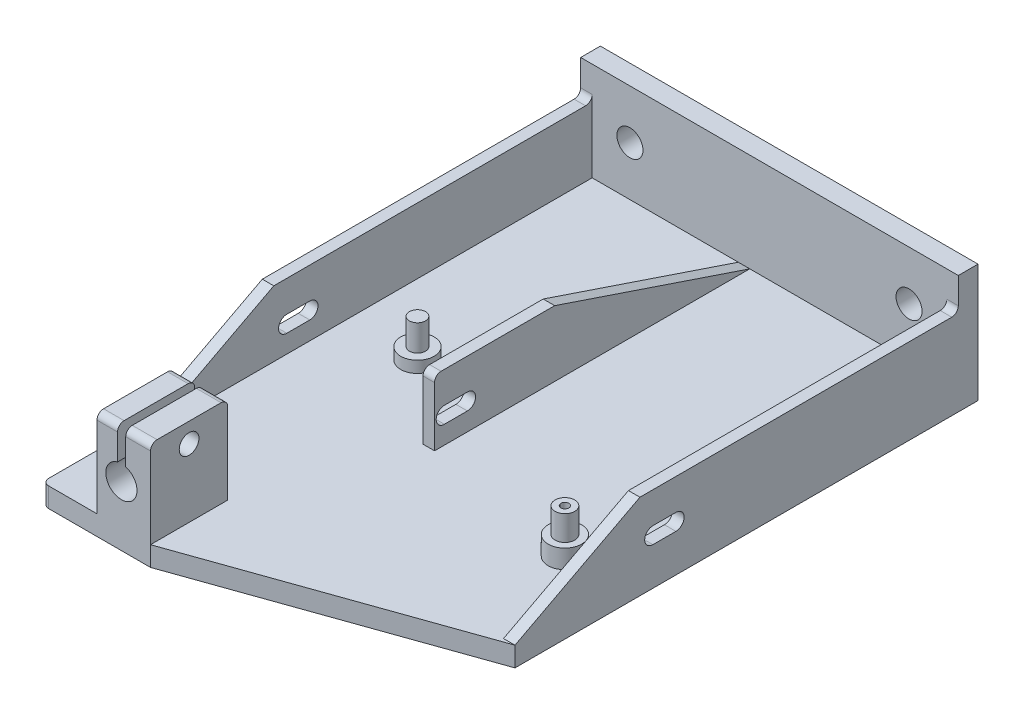
from build123d import *

# Parameters (mm, degrees)
SKETCH1_W                               = 115
SKETCH1_H                               = 170
BACK_WALL_EXTRUDE_DEPTH                 = 6
SKETCH2_W                               = 115
SKETCH2_H                               = 6
BOTTOM_PLATE_EXTRUDE_DEPTH              = 30
SKETCH3_W                               = 3.5
SKETCH3_H                               = 135
SKETCH3_H_2                             = 96
SIDE_WALLS_EXTRUDE_DEPTH                = 20
SKETCH4_W                               = 16.3
SKETCH4_H                               = 23.5
DIAL_INDIACTOR_HOLDER_EXTRUDE_DEPTH     = 26.7
DIAL_INDICATOR_HOLE_CUT_DEPTH           = 26.7
SKETCH6_R                               = 3
DIAL_INDICATOR_TIGHTENER_HOLE_CUT_DEPTH = 26.7
SKETCH7_R                               = 5.1
ARM_BASE_EXTRUDE_DEPTH                  = 5.7
SKETCH8_R                               = 3
ARM_AXLE_EXTRUDE_DEPTH                  = 7.6
SKETCH9_R                               = 5.1
GUIDE_WHEEL_BASE_EXTRUDE_DEPTH          = 3.5
SKETCH10_R                              = 2.45
GUIDE_WHEEL_AXLE_EXTRUDE_DEPTH          = 8
FILAMENT_START                          = 71.967294703
FILAMENT_SLOT_CUT_OUTLINE_W             = 100
FILAMENT_SLOT_CUT_OUTLINE_H             = 6
FILAMENT_SLOT_CUT_DEPTH                 = 27.34055864
FILAMENT_START_2                        = -115
FILAMENT_SLOT_CUT_2_DEPTH               = 116
SKETCH13_R                              = 3.96875
MOUNTING_HOLES_CUT_DEPTH                = 8
FILLET1_R                               = 2
CUT_EXTRUDE9_DEPTH                      = 8
SKETCH15_R                              = 1.225
SCREW_HOLE_CUT_DEPTH                    = 105.420974904
CUT_EXTRUDE11_DEPTH                     = 148.465250144


with BuildPart() as part:
    # Sketch1 → Back Wall Extrude (new body)
    with BuildSketch(Plane(origin=(0, 0, 0), x_dir=(1, 0, 0), z_dir=(0, 1, 0))):
        Rectangle(SKETCH1_W, SKETCH1_H)
    extrude(amount=BACK_WALL_EXTRUDE_DEPTH)

    # Sketch2 → Bottom Plate Extrude (add)
    with BuildSketch(Plane(origin=(0, 6, 0), x_dir=(1, 0, 0), z_dir=(0, 1, 0))):
        with Locations((0, 82)):
            Rectangle(SKETCH2_W, SKETCH2_H)
    extrude(amount=BOTTOM_PLATE_EXTRUDE_DEPTH)

    # Sketch3 → Side Walls Extrude (add)
    with BuildSketch(Plane(origin=(0, 6, 0), x_dir=(1, 0, 0), z_dir=(0, 1, 0))):
        with Locations((-55.75, 11.5)):
            Rectangle(SKETCH3_W, SKETCH3_H)
        with Locations((55.75, 11.5)):
            Rectangle(SKETCH3_W, SKETCH3_H)
        with Locations((-7.75, 31)):
            Rectangle(SKETCH3_W, SKETCH3_H_2)
    extrude(amount=SIDE_WALLS_EXTRUDE_DEPTH)

    # Sketch4 → Dial Indiactor Holder Extrude (add)
    with BuildSketch(Plane(origin=(0, 6, 0), x_dir=(1, 0, 0), z_dir=(0, 1, 0))):
        with Locations((-32.65, -73.25)):
            Rectangle(SKETCH4_W, SKETCH4_H)
    extrude(amount=DIAL_INDIACTOR_HOLDER_EXTRUDE_DEPTH)

    # Sketch5 → Dial Indicator Hole Cut (cut)
    with BuildSketch(Plane.XY.offset(85)):
        with BuildLine():
            Line((-34.538403692, 32.7), (-32.038403692, 32.7))
            Line((-32.038403692, 32.7), (-32.038403692, 22.762553146))
            ThreePointArc((-32.038403692, 22.762553146), (-33.433435972, 13.450573614), (-34.538403692, 22.801409096))
            Line((-34.538403692, 22.801409096), (-34.538403692, 32.7))
        make_face()
    extrude(amount=-DIAL_INDICATOR_HOLE_CUT_DEPTH, mode=Mode.SUBTRACT)

    # Sketch6 → Dial Indicator Tightener Hole Cut (cut)
    with BuildSketch(Plane.ZY.offset(40.8)):
        with Locations((73.25, 26.7)):
            Circle(SKETCH6_R)
    extrude(amount=-DIAL_INDICATOR_TIGHTENER_HOLE_CUT_DEPTH, mode=Mode.SUBTRACT)

    # Sketch7 → Arm Base Extrude (add)
    with BuildSketch(Plane(origin=(0, 6, 0), x_dir=(1, 0, 0), z_dir=(0, 1, 0))):
        with Locations(Location((41.6, -24.9, 0), (0, 0, 90))):
            Circle(SKETCH7_R)
    extrude(amount=ARM_BASE_EXTRUDE_DEPTH)

    # Sketch8 → Arm Axle Extrude (add)
    with BuildSketch(Plane(origin=(0, 11.7, 0), x_dir=(1, 0, 0), z_dir=(0, 1, 0))):
        with Locations(Location((41.6, -24.9, 0), (0, 0, 90))):
            Circle(SKETCH8_R)
    extrude(amount=ARM_AXLE_EXTRUDE_DEPTH)

    # Sketch9 → Guide Wheel Base Extrude (add)
    with BuildSketch(Plane(origin=(0, 6, 0), x_dir=(1, 0, 0), z_dir=(0, 1, 0))):
        with Locations(Location((-32.6, 4.4, 0), (0, 0, 90))):
            Circle(SKETCH9_R)
    extrude(amount=GUIDE_WHEEL_BASE_EXTRUDE_DEPTH)

    # Sketch10 → Guide Wheel Axle Extrude (add)
    with BuildSketch(Plane(origin=(0, 9.5, 0), x_dir=(1, 0, 0), z_dir=(0, 1, 0))):
        with Locations(Location((-32.6, 4.4, 0), (0, 0, 270))):
            Circle(SKETCH10_R)
    extrude(amount=GUIDE_WHEEL_AXLE_EXTRUDE_DEPTH)

    # Filament Slot Cut: read off the stored shape, not the designer's step
    # Filament Slot Cut outline → Filament Slot Cut (cut)
    with BuildSketch(Plane(origin=(0, 0, 0), x_dir=(0.942777884125997, 0, -0.333421446825048), z_dir=(0.333421446825048, 0, 0.942777884125997)).offset(FILAMENT_START)):
        with Locations((-3, 3)):
            Rectangle(FILAMENT_SLOT_CUT_OUTLINE_W, FILAMENT_SLOT_CUT_OUTLINE_H)
    extrude(amount=FILAMENT_SLOT_CUT_DEPTH, mode=Mode.SUBTRACT)

    # Filament Slot Cut 2 outline → Filament Slot Cut 2 (cut)
    with BuildSketch(Plane.ZY.offset(57.5).offset(FILAMENT_START_2)):
        with BuildLine():
            ThreePointArc((14, 11.51558642), (16.5, 14.01558642), (14, 16.51558642))
            Line((14, 16.51558642), (7, 16.51558642))
            ThreePointArc((7, 16.51558642), (4.5, 14.01558642), (7, 11.51558642))
            Line((7, 11.51558642), (14, 11.51558642))
        make_face()
    extrude(amount=FILAMENT_SLOT_CUT_2_DEPTH, mode=Mode.SUBTRACT)

    # Sketch13 → Mounting Holes Cut (cut)
    with BuildSketch(Plane(origin=(0, 0, -85), x_dir=(-1, 0, 0), z_dir=(0, 0, -1))):
        with Locations((42.5, 21)):
            Circle(SKETCH13_R)
        with Locations((-42.5, 21)):
            Circle(SKETCH13_R)
    extrude(amount=-MOUNTING_HOLES_CUT_DEPTH, mode=Mode.SUBTRACT)

    # Fillet1
    fillet1_edges = [part.edges().sort_by_distance(p)[0] for p in [
        (-55.75, 26, 56),
        (-55.75, 26, -79),
        (55.75, 26, -79),
        (55.75, 26, 56),
        (-7.75, 26, 17),
        (-37.669201846, 32.7, 85),
        (-28.269201846, 32.7, 61.5),
        (-57.5, 3, 85),
        (-28.269201846, 32.7, 85),
        (-37.669201846, 32.7, 61.5),
    ]]
    fillet(fillet1_edges, radius=FILLET1_R)

    # Sketch14 → Cut-Extrude9 (cut)
    with BuildSketch(Plane.ZY.offset(9.5)):
        Polygon((-79, 6), (-19.585405324, 26), (-79, 26), align=None)
    extrude(amount=-CUT_EXTRUDE9_DEPTH, mode=Mode.SUBTRACT)

    # Sketch15 → Screw Hole Cut (cut, through all)
    with BuildSketch(Plane(origin=(0, 19.3, 0), x_dir=(1, 0, 0), z_dir=(0, 1, 0))):
        with Locations(Location((41.6, -24.9, 0), (0, 0, 270))):
            Circle(SKETCH15_R)
    extrude(amount=-SCREW_HOLE_CUT_DEPTH, mode=Mode.SUBTRACT)

    # Sketch16 → Cut-Extrude11 (cut, through all)
    with BuildSketch(Plane.ZY.offset(57.5)):
        Polygon((56, 6), (17.948284572, 26), (56, 26), align=None)
    extrude(amount=-CUT_EXTRUDE11_DEPTH, mode=Mode.SUBTRACT)


solid = part.part
